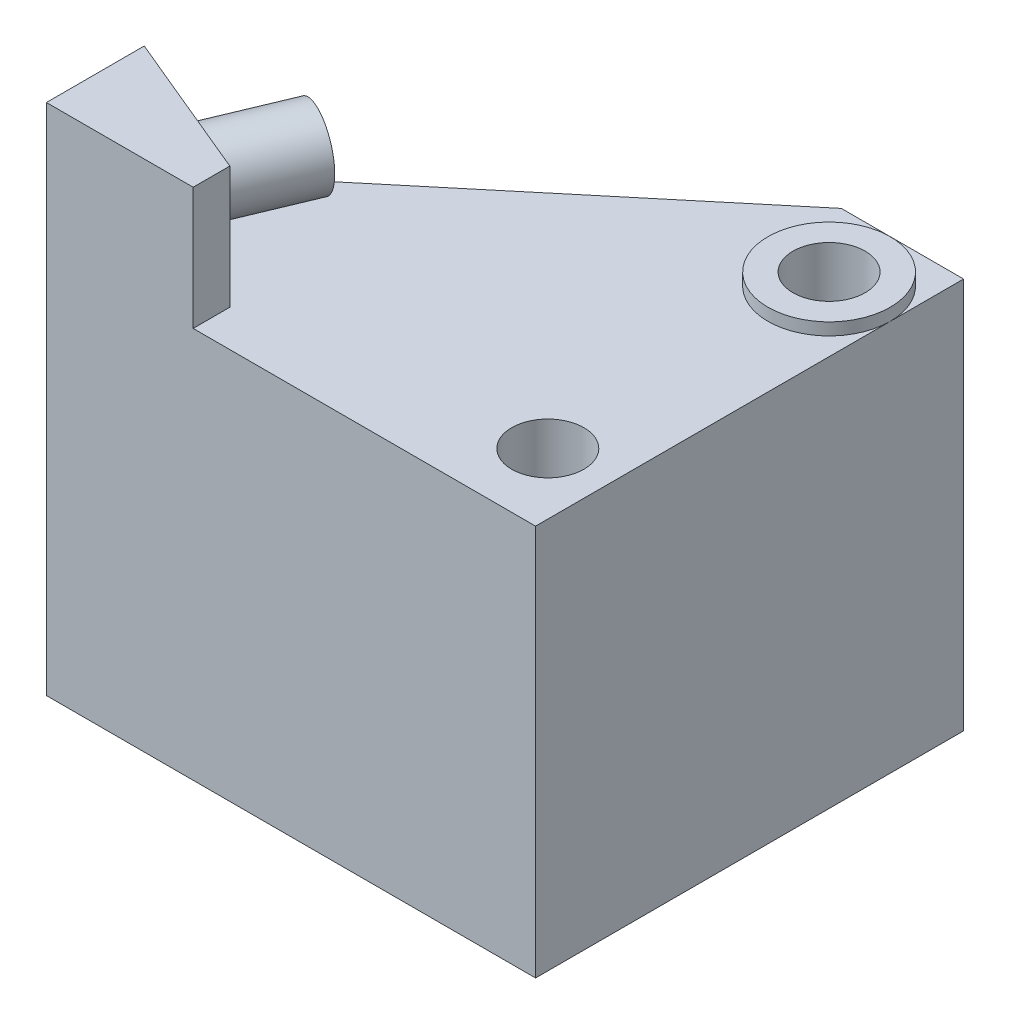
from build123d import *

# Parameters (mm, degrees)
EXTRUDE_1_DEPTH     = 16
SKETCH_3_R          = 1.475
CUT_EXTRUDE_1_DEPTH = 32.020154738
EXTRUDE_2_DEPTH     = 5
EXTRUDE_START       = 0.5
SKETCH_5_R          = 2.5
SKETCH_5_R_2        = 1.475
EXTRUDE_3_DEPTH     = 0.5
SKETCH_6_R          = 1.5
EXTRUDE_4_DEPTH     = 4


with BuildPart() as part:
    # Эскиз2 → Бобышка-Вытянуть1 (new body)
    with BuildSketch(Plane(origin=(0, 0, 0), x_dir=(1, 0, 0), z_dir=(0, 1, 0))):
        Polygon((-20, 5), (-5, 17.5), (0, 17.5), (0, 0), (-20, 0), align=None)
    extrude(amount=EXTRUDE_1_DEPTH)

    # Эскиз3 → Вырез-Вытянуть1 (cut, through all)
    with BuildSketch(Plane(origin=(0, 16, 0), x_dir=(1, 0, 0), z_dir=(0, 1, 0))):
        with Locations((-2.5, 14.5)):
            Circle(SKETCH_3_R)
        with Locations((-2.5, 3)):
            Circle(SKETCH_3_R)
    extrude(amount=-CUT_EXTRUDE_1_DEPTH, mode=Mode.SUBTRACT)

    # Эскиз4 → Бобышка-Вытянуть2 (add)
    with BuildSketch(Plane(origin=(0, 16, 0), x_dir=(1, 0, 0), z_dir=(0, 1, 0))):
        Polygon((-20, 4), (-20, 0), (-14, 0), (-14, 1.5), align=None)
    extrude(amount=EXTRUDE_2_DEPTH)

    # Эскиз5 → Бобышка-Вытянуть3 (add)
    with BuildSketch(Plane(origin=(0, 16, 0), x_dir=(1, 0, 0), z_dir=(0, 1, 0)).offset(EXTRUDE_START)):
        with Locations((-2.5, 14.5)):
            Circle(SKETCH_5_R)
        with Locations((-2.5, 14.5)):
            Circle(SKETCH_5_R_2, mode=Mode.SUBTRACT)
    extrude(amount=-EXTRUDE_3_DEPTH)

    # Эскиз6 → Бобышка-Вытянуть4 (add)
    with BuildSketch(Plane(origin=(-1.538461538, 0, 3.692307692), x_dir=(-0.9230769230769231, 0, -0.3846153846153845), z_dir=(0.3846153846153845, 0, -0.9230769230769231))):
        with Locations((16.75, 18.5)):
            Circle(SKETCH_6_R)
    extrude(amount=EXTRUDE_4_DEPTH)


solid = part.part
